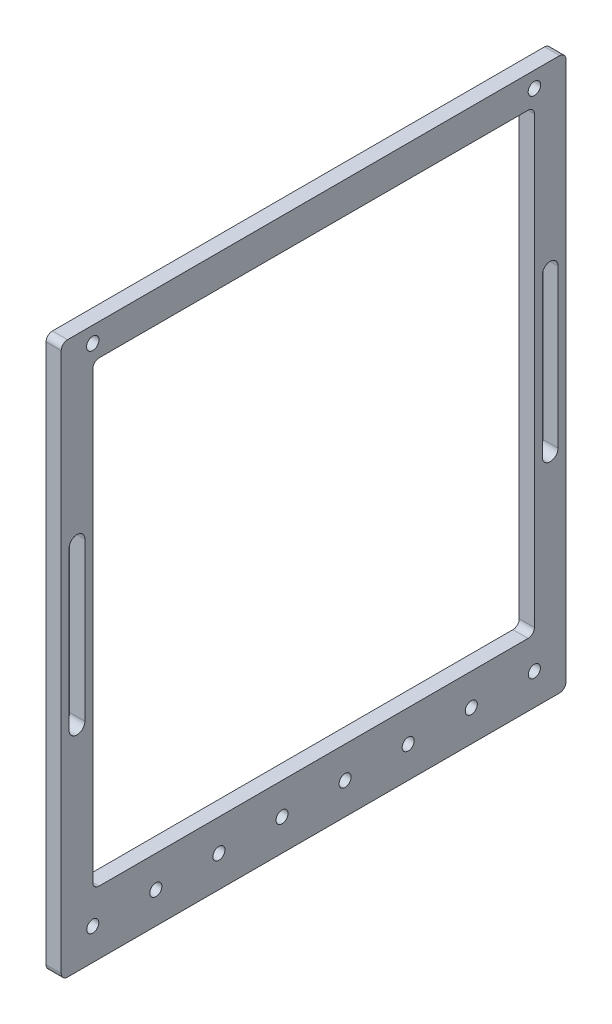
from build123d import *

# Parameters (mm, degrees)
SKETCH1_W               = 203.2
SKETCH1_H               = 222.25
SKETCH1_R               = 2.425
SKETCH1_W_2             = 177.8
SKETCH1_H_2             = 184.15
BOSS_EXTRUDE1_DEPTH     = 6.096
FILLET1_R               = 2.54
CUT_EXTRUDE1_DEPTH      = 284.264211852
CUT_EXTRUDE2_DEPTH      = 284.264211852
CUT_EXTRUDE2_DEPTH_BACK = 284.264211852
SKETCH3_R               = 2.505


with BuildPart() as part:
    # Sketch1 → Boss-Extrude1 (new body)
    with BuildSketch(Plane(origin=(0, 0, 0), x_dir=(0, 0, -1), z_dir=(1, 0, 0))):
        with Locations((88.9, -98.425)):
            Rectangle(SKETCH1_W, SKETCH1_H)
        with Locations((0, -196.85)):
            Circle(SKETCH1_R, mode=Mode.SUBTRACT)
        with Locations((25.4, -196.85)):
            Circle(SKETCH1_R, mode=Mode.SUBTRACT)
        with Locations((50.8, -196.85)):
            Circle(SKETCH1_R, mode=Mode.SUBTRACT)
        with Locations((76.2, -196.85)):
            Circle(SKETCH1_R, mode=Mode.SUBTRACT)
        with Locations((101.6, -196.85)):
            Circle(SKETCH1_R, mode=Mode.SUBTRACT)
        with Locations((127, -196.85)):
            Circle(SKETCH1_R, mode=Mode.SUBTRACT)
        with Locations((152.4, -196.85)):
            Circle(SKETCH1_R, mode=Mode.SUBTRACT)
        with Locations((177.8, -196.85)):
            Circle(SKETCH1_R, mode=Mode.SUBTRACT)
        with Locations((88.9, -92.075)):
            Rectangle(SKETCH1_W_2, SKETCH1_H_2, mode=Mode.SUBTRACT)
    extrude(amount=BOSS_EXTRUDE1_DEPTH)

    # Fillet1
    fillet1_edges = [part.edges().sort_by_distance(p)[0] for p in [
        (3.048, 12.7, -190.5),
        (3.048, 12.7, 12.7),
        (3.048, -209.55, -190.5),
        (3.048, -209.55, 12.7),
        (3.048, -184.15, 0),
        (3.048, -184.15, -177.8),
        (3.048, 0, -177.8),
        (3.048, 0, 0),
    ]]
    fillet(fillet1_edges, radius=FILLET1_R)

    # Sketch2 → Cut-Extrude1 (cut, through all)
    with BuildSketch(Plane(origin=(6.096, 0, 0), x_dir=(0, 0, -1), z_dir=(1, 0, 0))):
        with BuildLine():
            Line((-3.175, -60.325), (-3.175, -123.825))
            ThreePointArc((-3.175, -123.825), (-6.35, -127), (-9.525, -123.825))
            Line((-9.525, -123.825), (-9.525, -60.325))
            ThreePointArc((-9.525, -60.325), (-6.35, -57.15), (-3.175, -60.325))
        make_face()
        with BuildLine():
            Line((180.975, -60.325), (180.975, -123.825))
            ThreePointArc((180.975, -123.825), (184.15, -127), (187.325, -123.825))
            Line((187.325, -123.825), (187.325, -60.325))
            ThreePointArc((187.325, -60.325), (184.15, -57.15), (180.975, -60.325))
        make_face()
    extrude(amount=-CUT_EXTRUDE1_DEPTH, mode=Mode.SUBTRACT)

    # Sketch3 → Cut-Extrude2 (cut, two sides: drawn at the far end of the back side and taken through both)
    with BuildSketch(Plane(origin=(6.096, 0, 0), x_dir=(0, 0, -1), z_dir=(1, 0, 0)).offset(-CUT_EXTRUDE2_DEPTH_BACK)):
        with Locations((177.8, 6.35)):
            Circle(SKETCH3_R)
        with Locations((0, 6.35)):
            Circle(SKETCH3_R)
    extrude(amount=CUT_EXTRUDE2_DEPTH + CUT_EXTRUDE2_DEPTH_BACK, mode=Mode.SUBTRACT)


solid = part.part
